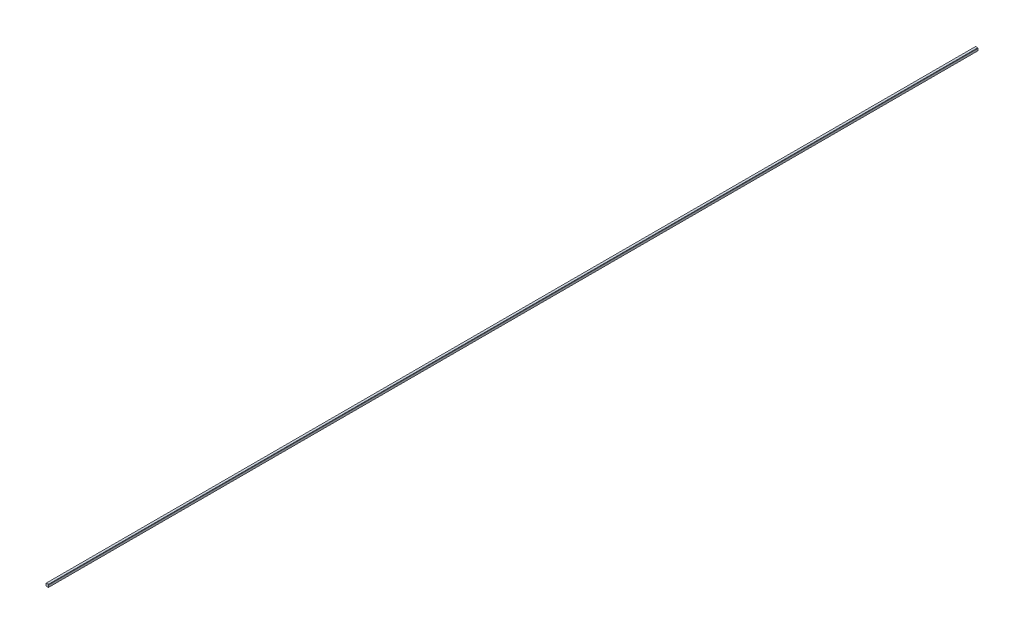
from build123d import *

# Parameters (mm, degrees)
BOSS_EXTRUDE1_DEPTH = 170


with BuildPart() as part:
    # Sketch1 → Boss-Extrude1 (new body)
    with BuildSketch(Plane.XY):
        Polygon((-0.2, 0.25), (-0.25, 0.2), (-0.25, -0.2), (-0.2, -0.25), (0.2, -0.25), (0.25, -0.2), (0.25, 0.2), (0.2, 0.25), align=None)
    extrude(amount=BOSS_EXTRUDE1_DEPTH)


solid = part.part
